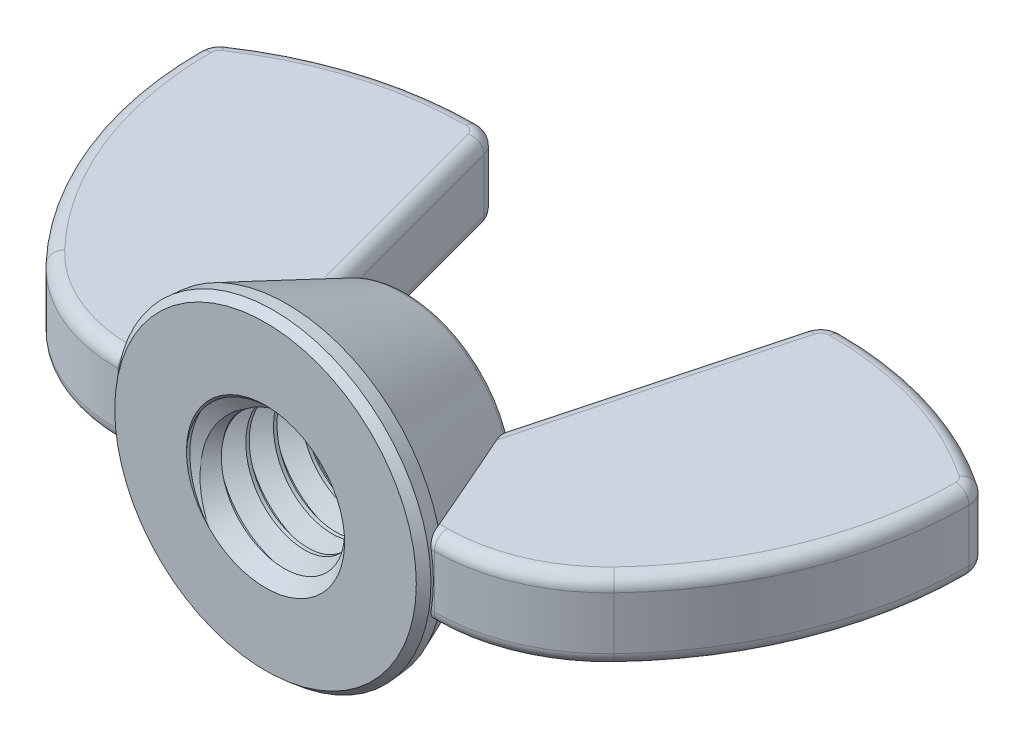
from build123d import *

# Parameters (mm, degrees)
EXTRUDE2_DEPTH     = 1
SKETCH3_R          = 4
EXTRUDE1_DEPTH     = 0.54
EXTRUDE1_DRAFT     = -5
SKETCH15_R         = 3.952756122
EXTRUDE3_DEPTH     = 3.06
EXTRUDE3_TAPER     = 22.581536516
FILLET3_R          = 0.254
SKETCH4_R          = 2
CUT_EXTRUDE1_DEPTH = 15.527990226
SWEEP1_PITCH       = 0.7
SKETCH7_R          = 4
CUT_EXTRUDE2_DEPTH = 15.527990253
SKETCH8_R          = 3.952756122
CUT_EXTRUDE3_DEPTH = 13.3297405
SKETCH11_R         = 1.9492
CUT_EXTRUDE5_DEPTH = 13.329740468
CUT_EXTRUDE5_TAPER = 45
CHAMFER1_SIZE      = 0.2025
CHAMFER1_SIZE2     = 0.186920125
FILLET4_R          = 0.333333333


with BuildPart() as part:
    # Sketch13 → Extrude2 (new, symmetric)
    with BuildSketch(Plane(origin=(0, 0, 0), x_dir=(1, 0, 0), z_dir=(0, 1, 0))):
        with BuildLine():
            Line((2.454661552, 0.27), (4, 0.27))
            ThreePointArc((4, 0.27), (5.731753934, 0.625019574), (7.184125317, 1.632803257))
            ThreePointArc((7.184125317, 1.632803257), (9.084678564, 4.588262139), (9.75, 8.038506658))
            ThreePointArc((9.75, 8.038506658), (9.684970885, 8.299324193), (9.505107169, 8.499083087))
            ThreePointArc((9.505107169, 8.499083087), (7.162624929, 9.616389801), (4.595829154, 10))
            ThreePointArc((4.595829154, 10), (4.25762836, 9.8851963), (4.059203695, 9.588232803))
            Line((4.059203695, 9.588232803), (2.454661552, 3.6))
            Line((2.454661552, 3.6), (2.454661552, 0.27))
        make_face()
    extrude(amount=EXTRUDE2_DEPTH, both=True)

    # Fillet4
    fillet4_edges = [part.edges().sort_by_distance(p)[0] for p in [
        (5.731753934, 1, -0.625019574),
        (3.227330776, -1, -0.27),
        (9.084678564, 1, -4.588262139),
        (9.684970885, 1, -8.299324193),
        (7.162624929, 1, -9.616389801),
        (4.25762836, 1, -9.8851963),
        (3.256932623, 1, -6.594116401),
        (3.227330776, 1, -0.27),
        (3.256932623, -1, -6.594116401),
        (4.25762836, -1, -9.8851963),
        (7.162624929, -1, -9.616389801),
        (9.684970885, -1, -8.299324193),
        (9.084678564, -1, -4.588262139),
        (5.731753934, -1, -0.625019574),
    ]]
    fillet(fillet4_edges, radius=FILLET4_R)


with BuildPart() as body_2:
    # Sketch3 → Extrude1 (with draft: the straight prism first)
    with BuildSketch(Plane.XY):
        Circle(SKETCH3_R)
    extrude(amount=-EXTRUDE1_DEPTH)
    # Extrude1: the draft: its side faces are tilted about the plane it starts from
    extrude1_sides = [body_2.faces().sort_by_distance(p)[0] for p in [
        (-4, 0, -0.27),
    ]]
    draft(extrude1_sides, Plane.XY, EXTRUDE1_DRAFT)

    # Sketch15 → Extrude3 (add)
    with BuildSketch(Plane(origin=(0, 0, -0.54), x_dir=(-1, 0, 0), z_dir=(0, 0, -1))):
        Circle(SKETCH15_R)
    extrude(amount=EXTRUDE3_DEPTH, taper=EXTRUDE3_TAPER)

    # Fillet3
    fillet3_edges = [body_2.edges().sort_by_distance(p)[0] for p in [
        (2.680157846, 0, -3.6),
    ]]
    fillet(fillet3_edges, radius=FILLET3_R)

    # Sketch4 → Cut-Extrude1 (cut, through all)
    with BuildSketch(Plane.XY):
        Circle(SKETCH4_R)
    extrude(amount=-CUT_EXTRUDE1_DEPTH, mode=Mode.SUBTRACT)

    # Sweep1: the profile of Sketch6 profile screwed along a right-hand helix of 8 turns, 6 arcs to a turn; built about Z, then put on its axis
    sweep1_z = Axis((0, 0, 0), (0, 0, 1))
    sweep1_corners = [(2.0003, 0, -0.612673205), (1.545336663, 0, -0.35), (1.545336663, 0, -0.2625), (2.0003, 0, 0.000173205)]
    with BuildLine(mode=Mode.PRIVATE) as sweep1_profile:
        Line(sweep1_corners[0], sweep1_corners[1])
        Line(sweep1_corners[1], sweep1_corners[2])
        Line(sweep1_corners[2], sweep1_corners[3])
        Line(sweep1_corners[3], sweep1_corners[0])
    sweep1_cap = Face(sweep1_profile.wire())
    sweep1_turn_angles = [0, 30, 60, 90, 120, 150, 180, 210, 240, 270, 300, 330, 360]
    sweep1_turn_weights = [1, 0.8660254037844387, 1, 0.8660254037844387, 1, 0.8660254037844387, 1, 0.8660254037844387, 1, 0.8660254037844387, 1, 0.8660254037844387, 1]
    sweep1_turn_rails = [Edge.make_bspline([Vector(p[0], p[1], 0).rotate(sweep1_z, sweep1_turn_angles[k]) / sweep1_turn_weights[k] + Vector(0, 0, p[2] + SWEEP1_PITCH * sweep1_turn_angles[k] / 360) for k in range(13)], [0, 0, 0, 1, 1, 2, 2, 3, 3, 4, 4, 5, 5, 6, 6, 6], 2, sweep1_turn_weights) for p in sweep1_corners]
    sweep1_turn_sides = [Face.make_surface_from_curves(sweep1_turn_rails[p[0]], sweep1_turn_rails[p[1]]) for p in [(0, 1), (1, 2), (2, 3), (3, 0)]]
    sweep1 = Plane(origin=(0, 0, 0), x_dir=(-1, 0, 0), z_dir=(0, 0, -1)) * Solid(Shell([*[p.moved(Location((0, 0, SWEEP1_PITCH * i))) for i in range(8) for p in sweep1_turn_sides], sweep1_cap, sweep1_cap.rotate(sweep1_z, 2880).moved(Location((0, 0, SWEEP1_PITCH * 2880 / 360)))]))
    add(sweep1)

    # Sketch7 → Cut-Extrude2 (cut, through all)
    with BuildSketch(Plane.XY):
        Circle(SKETCH7_R)
    extrude(amount=CUT_EXTRUDE2_DEPTH, mode=Mode.SUBTRACT)

    # Sketch8 → Cut-Extrude3 (cut, through all)
    with BuildSketch(Plane.XY.offset(-3.6)):
        Circle(SKETCH8_R)
    extrude(amount=-CUT_EXTRUDE3_DEPTH, mode=Mode.SUBTRACT)

    # Cut-Extrude4 cone 1 section (through the dimple's axis) → Cut-Extrude4 (revolve, cut)
    with BuildSketch(Plane(origin=(0, 0, 0), x_dir=(0, -1, 0), z_dir=(1, 0, 0))):
        Polygon((0, 0), (2, 0), (0, 2), align=None)
    revolve(axis=Axis((0, 0, 0), (0, 0, -1)), mode=Mode.SUBTRACT)

    # Sketch11 → Cut-Extrude5 (cut, through all)
    with BuildSketch(Plane.XY.offset(-3.6)):
        Circle(SKETCH11_R)
    extrude(amount=CUT_EXTRUDE5_DEPTH, taper=CUT_EXTRUDE5_TAPER, mode=Mode.SUBTRACT)

    # Chamfer1
    chamfer1_edges = [body_2.edges().sort_by_distance(p)[0] for p in [
        (-4, 0, 0),
    ]]
    chamfer1_side = [body_2.faces().sort_by_distance(p)[0] for p in [
        (-3.976378061, 0, -0.27),
    ]]
    chamfer(chamfer1_edges, length=CHAMFER1_SIZE, length2=CHAMFER1_SIZE2, reference=chamfer1_side[0])


with BuildPart() as body_3:
    # Mirror6: mirrored copy
    add(part.part.mirror(Plane(origin=(0, 0, 0), x_dir=(0, 0, 1), z_dir=(1, 0, 0))))

    # Combine2: union part, body 2
    add(part.part)
    add(body_2.part)


solid = body_3.part
